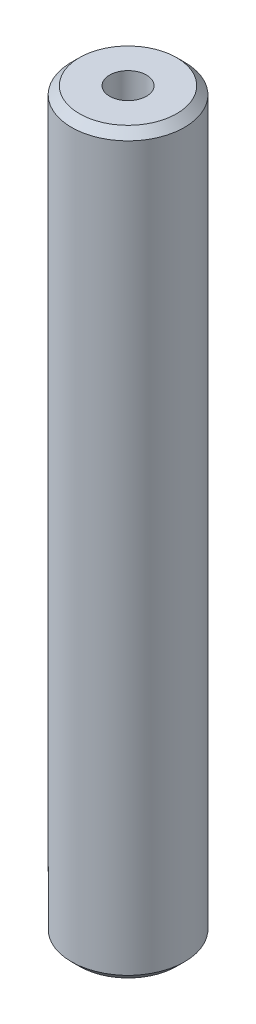
from build123d import *

# Parameters (mm, degrees)
SKETCH1_R           = 27.5
BOSS_EXTRUDE1_DEPTH = 359.332639634
SKETCH2_R           = 8.959648285
CUT_EXTRUDE1_DEPTH  = 362.431108106
CHAMFER1_SIZE       = 3.844249198


with BuildPart() as part:
    # Sketch1 → Boss-Extrude1 (new body)
    with BuildSketch(Plane(origin=(0, 0, 0), x_dir=(1, 0, 0), z_dir=(0, 1, 0))):
        Circle(SKETCH1_R)
    extrude(amount=BOSS_EXTRUDE1_DEPTH)

    # Sketch2 → Cut-Extrude1 (cut, through all)
    with BuildSketch(Plane(origin=(0, 0, 0), x_dir=(1, 0, 0), z_dir=(0, 1, 0))):
        Circle(SKETCH2_R)
    extrude(amount=CUT_EXTRUDE1_DEPTH, mode=Mode.SUBTRACT)

    # Chamfer1
    chamfer1_edges = [part.edges().sort_by_distance(p)[0] for p in [
        (-27.5, 359.332639634, 0),
        (-27.5, 0, 0),
    ]]
    chamfer(chamfer1_edges, length=CHAMFER1_SIZE)


solid = part.part
